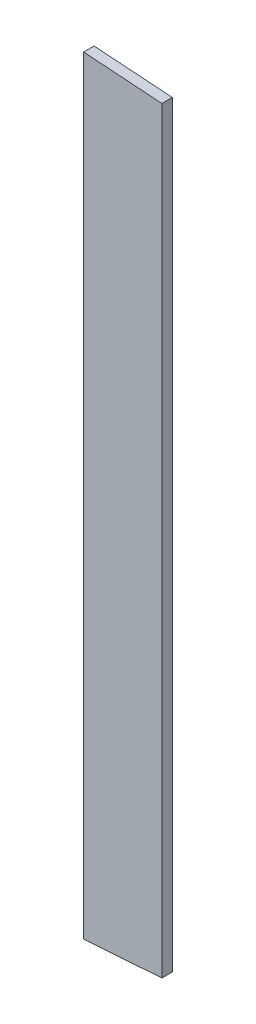
from build123d import *

# Parameters (mm, degrees)
BOSS_EXTRUDE1_DEPTH = 2


with BuildPart() as part:
    # Sketch1 → Boss-Extrude1 (new body)
    with BuildSketch(Plane.XY.offset(3242.699999999)):
        Polygon((-49.769678516, 346.108282384), (-64.769678516, 345.059380205), (-64.769678516, 492.415801833), (-49.769678516, 491.366899654), align=None)
    extrude(amount=BOSS_EXTRUDE1_DEPTH)


solid = part.part
